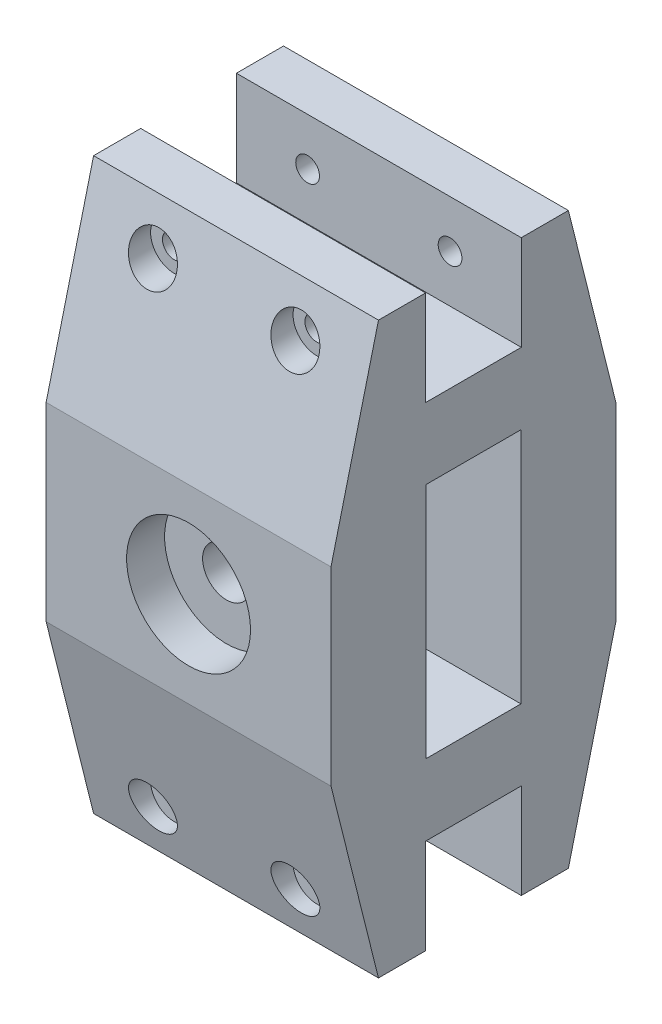
from build123d import *

# Parameters (mm, degrees)
BOSS_EXTRUDE1_DEPTH = 60
SKETCH3_R           = 5.05
CUT_EXTRUDE1_DEPTH  = 70
SKETCH4_R           = 13.05
CUT_EXTRUDE2_DEPTH  = 8
SKETCH5_R           = 2.5
CUT_EXTRUDE3_DEPTH  = 147.969384567
SKETCH6_R           = 5
CUT_EXTRUDE4_DEPTH  = 12
SKETCH7_W           = 20
SKETCH7_H           = 50
CUT_EXTRUDE5_DEPTH  = 81


with BuildPart() as part:
    # Sketch2 → Boss-Extrude1 (new body)
    with BuildSketch(Plane(origin=(0, 0, 0), x_dir=(0, 0, -1), z_dir=(1, 0, 0))):
        Polygon((0, 40), (10, 0), (19.925, 0), (19.925, 20), (40.075, 20), (40.075, 0), (50, 0), (60, 40), (60, 80), (50, 120), (40.075, 120), (40.075, 100), (19.925, 100), (19.925, 120), (10, 120), (0, 80), align=None)
    extrude(amount=BOSS_EXTRUDE1_DEPTH)

    # Sketch3 → Cut-Extrude1 (cut)
    with BuildSketch(Plane.XY):
        with Locations((30, 60)):
            Circle(SKETCH3_R)
    extrude(amount=-CUT_EXTRUDE1_DEPTH, mode=Mode.SUBTRACT)

    # Sketch4 → Cut-Extrude2 (cut)
    with BuildSketch(Plane.XY):
        with Locations((30, 60)):
            Circle(SKETCH4_R)
    cut_extrude2 = extrude(amount=-CUT_EXTRUDE2_DEPTH, mode=Mode.SUBTRACT)

    # Mirror1: Cut-Extrude2 across plane
    add(cut_extrude2.mirror(Plane.XY.offset(-30)), mode=Mode.SUBTRACT)

    # Sketch5 → Cut-Extrude3 (cut, through all)
    with BuildSketch(Plane.XY):
        with Locations((45, 110)):
            Circle(SKETCH5_R)
        with Locations((15, 110)):
            Circle(SKETCH5_R)
        with Locations((45, 10)):
            Circle(SKETCH5_R)
        with Locations((15, 10)):
            Circle(SKETCH5_R)
    extrude(amount=-CUT_EXTRUDE3_DEPTH, mode=Mode.SUBTRACT)

    # Sketch6 → Cut-Extrude4 (cut)
    with BuildSketch(Plane.XY):
        with Locations((45, 110)):
            Circle(SKETCH6_R)
        with Locations((15, 110)):
            Circle(SKETCH6_R)
        with Locations((15, 10)):
            Circle(SKETCH6_R)
        with Locations((45, 10)):
            Circle(SKETCH6_R)
    cut_extrude4 = extrude(amount=-CUT_EXTRUDE4_DEPTH, mode=Mode.SUBTRACT)

    # Mirror2: Cut-Extrude4 across plane
    add(cut_extrude4.mirror(Plane.XY.offset(-30)), mode=Mode.SUBTRACT)

    # Sketch7 → Cut-Extrude5 (cut)
    with BuildSketch(Plane(origin=(60, 0, 0), x_dir=(0, 0, -1), z_dir=(1, 0, 0))):
        with Locations((30, 60)):
            Rectangle(SKETCH7_W, SKETCH7_H)
    extrude(amount=-CUT_EXTRUDE5_DEPTH, mode=Mode.SUBTRACT)


solid = part.part
